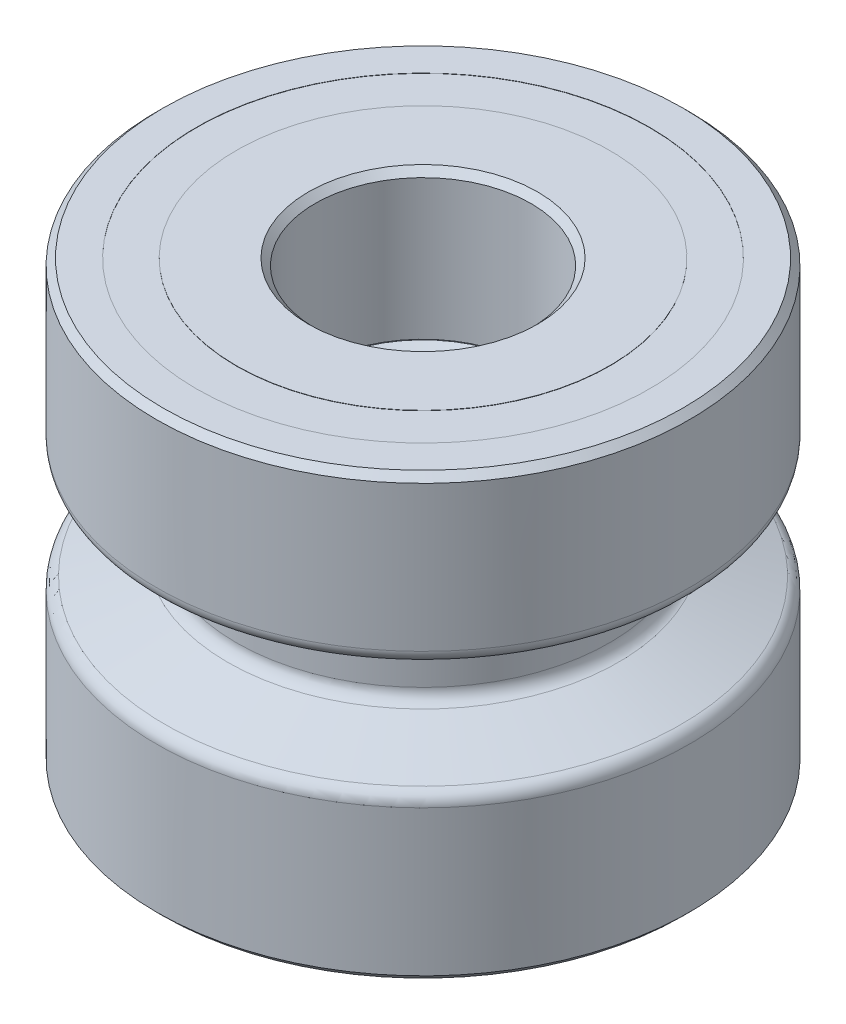
from build123d import *

# Parameters (mm, degrees)
SKETCH1_R           = 10
BOSS_EXTRUDE1_DEPTH = 8.25
CUT_EXTRUDE1_REACH  = 23.731
SKETCH2_R           = 3.5
FILLET4_R           = 0.5
SKETCH11_R          = 4.05
CUT_EXTRUDE2_DEPTH  = 2.5
CUT_EXTRUDE3_START  = -5.5
SKETCH12_R          = 4.05
CUT_EXTRUDE3_DEPTH  = 5.5
CUT_EXTRUDE4_START  = -0.01
SKETCH13_R          = 8.5
SKETCH13_R_2        = 7
CUT_EXTRUDE4_DEPTH  = 0.01
CHAMFER1_SIZE       = 0.25
CHAMFER2_SIZE       = 0.3
CHAMFER2_SIZE2      = 0.519615242


with BuildPart() as part:
    # Sketch1 → Boss-Extrude1 (new, symmetric)
    with BuildSketch(Plane(origin=(0, 0, 0), x_dir=(1, 0, 0), z_dir=(0, 1, 0))):
        Circle(SKETCH1_R)
    extrude(amount=BOSS_EXTRUDE1_DEPTH, both=True)

    # Sketch2 → Cut-Extrude1 (cut, up to next)
    with BuildSketch(Plane.XZ.offset(8.25), mode=Mode.PRIVATE) as cut_extrude1_sk1:
        Circle(SKETCH2_R)
    cut_extrude1_tool1 = extrude(cut_extrude1_sk1.sketch, amount=-CUT_EXTRUDE1_REACH, mode=Mode.PRIVATE) & part.part
    add(cut_extrude1_tool1.solids().sort_by_distance((0, -8.25, 0))[0], mode=Mode.SUBTRACT)

    # Sketch10 → Cut-Revolve1 (revolve, cut)
    with BuildSketch(Plane.XY):
        Polygon((10, 2.191910703), (7, 1.1), (7, -1.1), (10, -2.191910703), align=None)
    revolve(axis=Axis((0, 8.25, 0), (0, -1, 0)), mode=Mode.SUBTRACT)

    # Fillet4
    fillet4_edges = [part.edges().sort_by_distance(p)[0] for p in [
        (-7, -1.1, 0),
        (-7, 1.1, 0),
        (-10, 2.191910703, 0),
        (-10, -2.191910703, 0),
    ]]
    fillet(fillet4_edges, radius=FILLET4_R)

    # Sketch11 → Cut-Extrude2 (cut)
    with BuildSketch(Plane.XZ.offset(8.25)):
        Circle(SKETCH11_R)
    extrude(amount=-CUT_EXTRUDE2_DEPTH, mode=Mode.SUBTRACT)

    # Sketch12 → Cut-Extrude3 (cut)
    with BuildSketch(Plane(origin=(0, 8.25, 0), x_dir=(1, 0, 0), z_dir=(0, 1, 0)).offset(CUT_EXTRUDE3_START)):
        Circle(SKETCH12_R)
    extrude(amount=CUT_EXTRUDE3_DEPTH, mode=Mode.SUBTRACT)

    # Sketch13 → Cut-Extrude4 (cut)
    with BuildSketch(Plane(origin=(0, 8.25, 0), x_dir=(1, 0, 0), z_dir=(0, 1, 0)).offset(CUT_EXTRUDE4_START)):
        Circle(SKETCH13_R)
        Circle(SKETCH13_R_2, mode=Mode.SUBTRACT)
    extrude(amount=CUT_EXTRUDE4_DEPTH, mode=Mode.SUBTRACT)

    # Chamfer1
    chamfer1_edges = [part.edges().sort_by_distance(p)[0] for p in [
        (-10, -8.25, 0),
        (-4.05, -8.25, 0),
        (-4.05, 8.25, 0),
        (-10, 8.25, 0),
    ]]
    chamfer(chamfer1_edges, length=CHAMFER1_SIZE)

    # Chamfer2
    chamfer2_edges = [part.edges().sort_by_distance(p)[0] for p in [
        (-3.5, 2.75, 0),
    ]]
    chamfer2_side = [part.faces().sort_by_distance(p)[0] for p in [
        (-3.5, -1.5, 0),
    ]]
    chamfer(chamfer2_edges, length=CHAMFER2_SIZE, length2=CHAMFER2_SIZE2, reference=chamfer2_side[0])


solid = part.part
